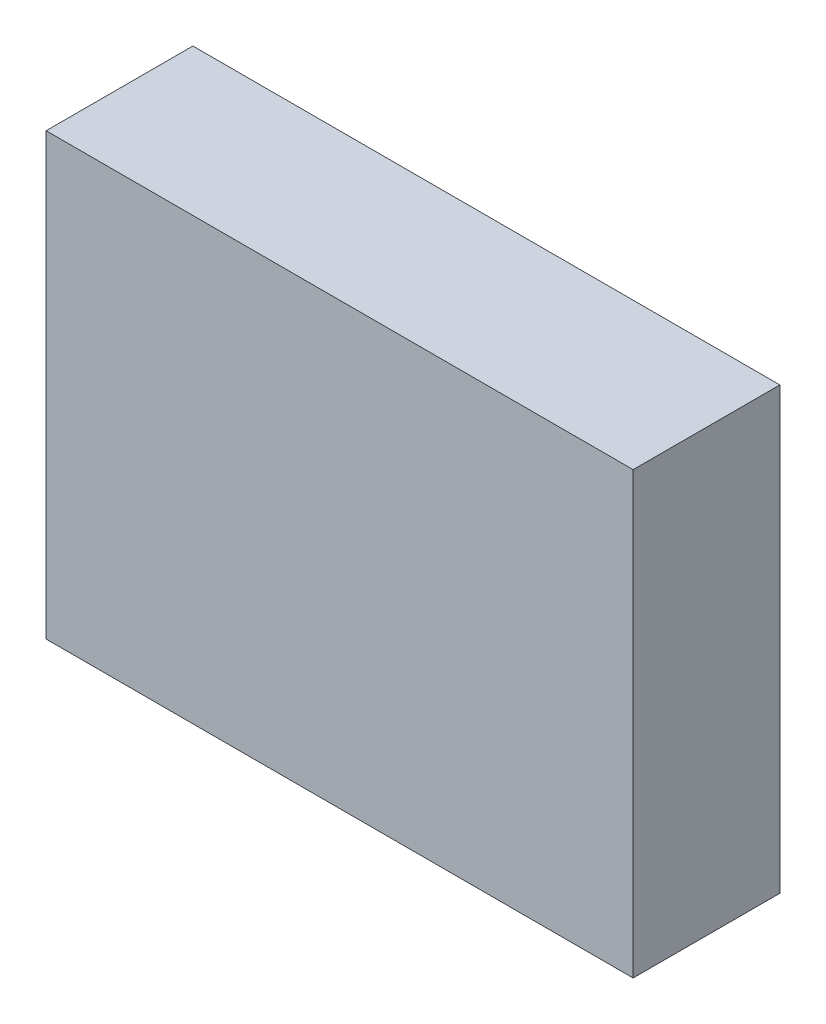
from build123d import *

# Parameters (mm, degrees)
SKETCH1_W           = 101.6
SKETCH1_H           = 76.2
BOSS_EXTRUDE1_DEPTH = 25.4
SKETCH2_R           = 2.794
CUT_EXTRUDE1_DEPTH  = 10.16
SHELL1_DEPTH        = 22.86
SHELL1_START        = 12.7
SHELL1_2_DEPTH      = 10.16


# Read off the part's stored shape, not the designer's step: Shell1
with BuildPart() as part:
    # Sketch1 → Boss-Extrude1 (new body)
    with BuildSketch(Plane.XY):
        Rectangle(SKETCH1_W, SKETCH1_H)
    extrude(amount=BOSS_EXTRUDE1_DEPTH)

    # Sketch2 → Cut-Extrude1 (cut)
    with BuildSketch(Plane(origin=(0, 0, 0), x_dir=(-1, 0, 0), z_dir=(0, 0, -1))):
        with Locations((45.72, -33.02)):
            Circle(SKETCH2_R)
        with Locations((-45.72, -33.02)):
            Circle(SKETCH2_R)
        with Locations((-45.72, 33.02)):
            Circle(SKETCH2_R)
        with Locations((45.72, 33.02)):
            Circle(SKETCH2_R)
    extrude(amount=-CUT_EXTRUDE1_DEPTH, mode=Mode.SUBTRACT)

    # Shell1 outline → Shell1 (cut)
    with BuildSketch(Plane.XY):
        with BuildLine():
            Line((41.029588931, 35.56), (-41.029588931, 35.56))
            ThreePointArc((-41.029588931, 35.56), (-41.948292429, 29.248292429), (-48.26, 28.329588931))
            Line((-48.26, 28.329588931), (-48.26, -28.329588931))
            ThreePointArc((-48.26, -28.329588931), (-41.948292429, -29.248292429), (-41.029588931, -35.56))
            Line((-41.029588931, -35.56), (41.029588931, -35.56))
            ThreePointArc((41.029588931, -35.56), (41.948292429, -29.248292429), (48.26, -28.329588931))
            Line((48.26, -28.329588931), (48.26, 28.329588931))
            ThreePointArc((48.26, 28.329588931), (41.948292429, 29.248292429), (41.029588931, 35.56))
        make_face()
    extrude(amount=SHELL1_DEPTH, mode=Mode.SUBTRACT)

    # Shell1 2 outline → Shell1 2 (cut)
    with BuildSketch(Plane.XY.offset(SHELL1_START)):
        with BuildLine():
            Line((-41.029588931, 35.56), (-48.26, 35.56))
            Line((-48.26, 35.56), (-48.26, 28.329588931))
            ThreePointArc((-48.26, 28.329588931), (-41.948292429, 29.248292429), (-41.029588931, 35.56))
        make_face()
        with BuildLine():
            Line((48.26, 35.56), (41.029588931, 35.56))
            ThreePointArc((41.029588931, 35.56), (41.948292429, 29.248292429), (48.26, 28.329588931))
            Line((48.26, 28.329588931), (48.26, 35.56))
        make_face()
        with BuildLine():
            ThreePointArc((-41.029588931, -35.56), (-41.948292429, -29.248292429), (-48.26, -28.329588931))
            Line((-48.26, -28.329588931), (-48.26, -35.56))
            Line((-48.26, -35.56), (-41.029588931, -35.56))
        make_face()
        with BuildLine():
            Line((48.26, -35.56), (48.26, -28.329588931))
            ThreePointArc((48.26, -28.329588931), (41.948292429, -29.248292429), (41.029588931, -35.56))
            Line((41.029588931, -35.56), (48.26, -35.56))
        make_face()
    extrude(amount=SHELL1_2_DEPTH, mode=Mode.SUBTRACT)


solid = part.part
